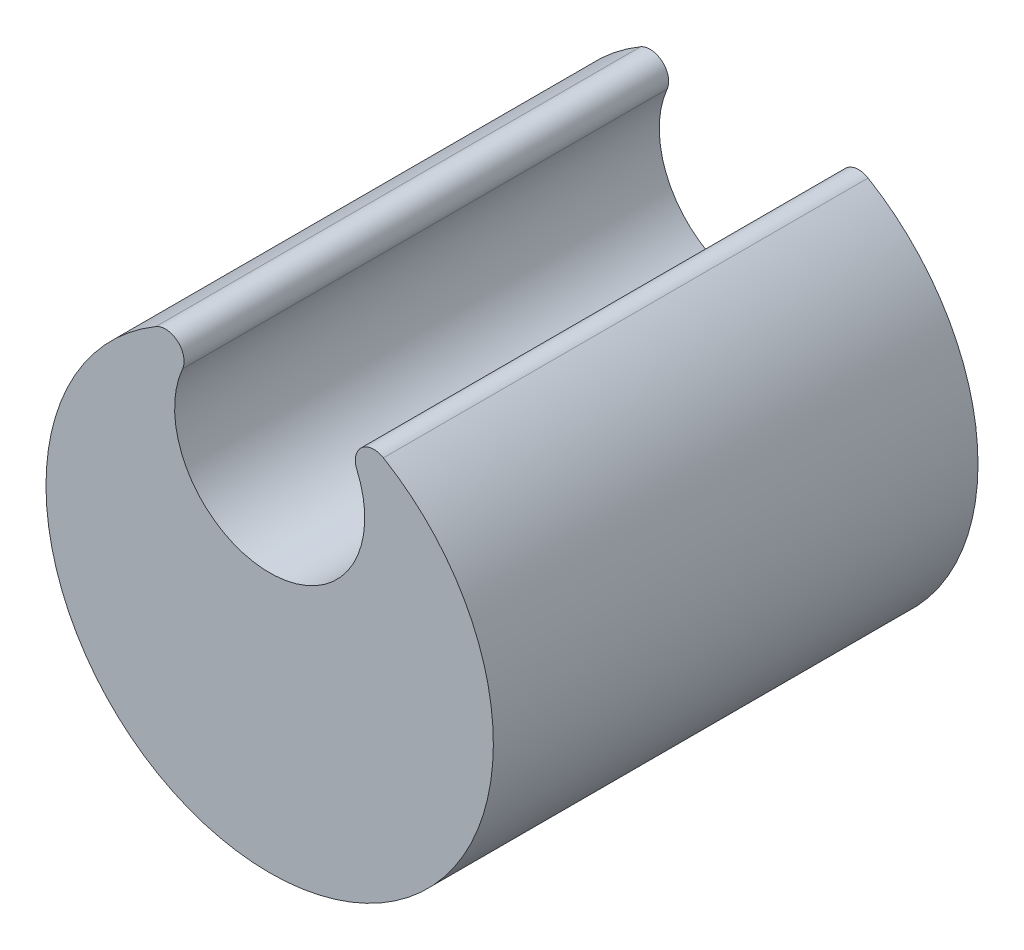
from build123d import *

# Parameters (mm, degrees)
AUFSATZ_LINEAR_AUSTRAGEN2_DEPTH = 13
VERRUNDUNG1_R                   = 0.5


with BuildPart() as part:
    # Skizze1 → Aufsatz-Linear austragen2 (new body)
    with BuildSketch(Plane.XY):
        with BuildLine():
            ThreePointArc((-0.771783993, 5.950155415), (-3.960384832, -4.507255482), (6, 0))
            ThreePointArc((6, 0), (4.507255482, 3.960384832), (0.771783993, 5.950155415))
            ThreePointArc((0.771783993, 5.950155415), (2.057978278, 5.025485179), (2.55, 3.519754323))
            ThreePointArc((2.55, 3.519754323), (-1.505730855, 1.461776046), (-0.771783993, 5.950155415))
        make_face()
    extrude(amount=AUFSATZ_LINEAR_AUSTRAGEN2_DEPTH)

    # Verrundung1
    verrundung1_edges = [part.edges().sort_by_distance(p)[0] for p in [
        (0.771783993, 5.950155415, 6.5),
        (-0.771783993, 5.950155415, 6.5),
    ]]
    fillet(verrundung1_edges, radius=VERRUNDUNG1_R)


solid = part.part
